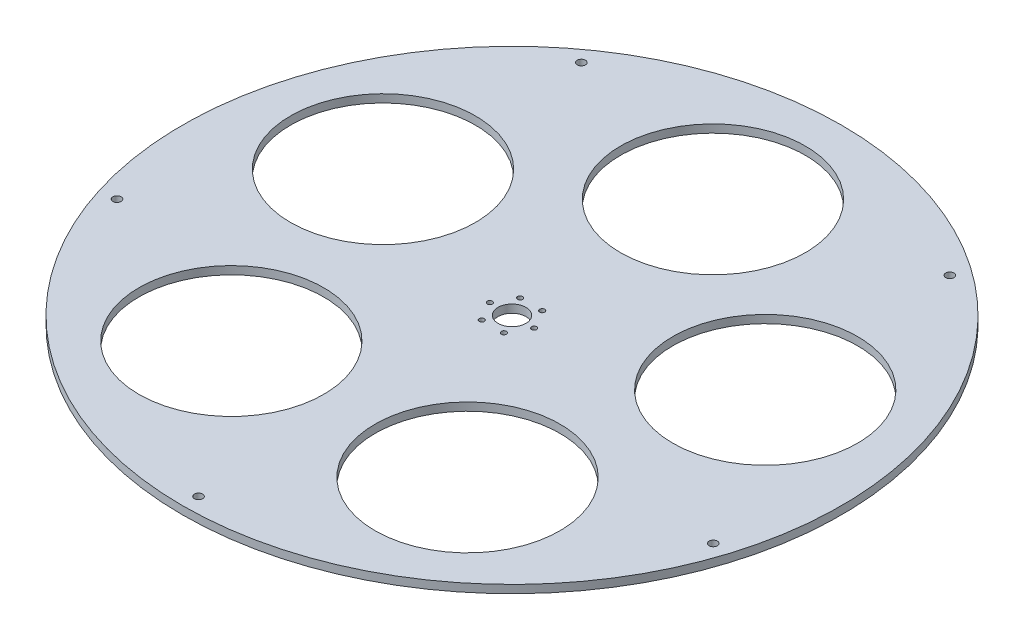
from build123d import *

# Parameters (mm, degrees)
SKETCH1_R              = 260.35
SKETCH1_R_2            = 73.025
BOSS_EXTRUDE1_DEPTH    = 6.35
SKETCH3_R              = 11
CUT_EXTRUDE1_DEPTH     = 374.646887366
F_10_32_TAPPED_HOLE1_D = 4.0386
SKETCH8_R              = 3.2512
CUT_EXTRUDE2_DEPTH     = 369.245254552


with BuildPart() as part:
    # Sketch1 → Boss-Extrude1 (new body)
    with BuildSketch(Plane(origin=(0, 0, 0), x_dir=(1, 0, 0), z_dir=(0, 1, 0))):
        Circle(SKETCH1_R)
        with Locations((0, 158.75)):
            Circle(SKETCH1_R_2, mode=Mode.SUBTRACT)
        with Locations((150.980221962, 49.056447857)):
            Circle(SKETCH1_R_2, mode=Mode.SUBTRACT)
        with Locations((93.310908801, -128.431447857)):
            Circle(SKETCH1_R_2, mode=Mode.SUBTRACT)
        with Locations((-93.310908801, -128.431447857)):
            Circle(SKETCH1_R_2, mode=Mode.SUBTRACT)
        with Locations((-150.980221962, 49.056447857)):
            Circle(SKETCH1_R_2, mode=Mode.SUBTRACT)
    extrude(amount=BOSS_EXTRUDE1_DEPTH)

    # Sketch3 → Cut-Extrude1 (cut, through all)
    with BuildSketch(Plane(origin=(-5.184519995, 6.35, -2.448578058), x_dir=(1, 0, 0), z_dir=(0, 1, 0))):
        with Locations((5.184519995, -2.448578058)):
            Circle(SKETCH3_R)
    extrude(amount=-CUT_EXTRUDE1_DEPTH, mode=Mode.SUBTRACT)

    # #10-32 Tapped Hole1 (through all)
    with Locations(Plane(origin=(-5.184519995, 6.35, -2.448578058), x_dir=(1, 0, 0), z_dir=(0, 1, 0))):
        with Locations((-3.546730005, 12.674390556), (13.915769995, 12.674390556), (22.647019995, -2.448578058), (13.915769995, -17.571546671), (-3.546730005, -17.571546671), (-12.277980005, -2.448578058)):
            Hole(F_10_32_TAPPED_HOLE1_D / 2)

    # Sketch8 → Cut-Extrude2 (cut, through all)
    with BuildSketch(Plane(origin=(0, 6.35, 0), x_dir=(1, 0, 0), z_dir=(0, 1, 0))):
        with Locations((0, -247.65)):
            Circle(SKETCH8_R)
        with Locations((-235.52914626, -76.528058657)):
            Circle(SKETCH8_R)
        with Locations((-145.56501773, 200.353058657)):
            Circle(SKETCH8_R)
        with Locations((145.56501773, 200.353058657)):
            Circle(SKETCH8_R)
        with Locations((235.52914626, -76.528058657)):
            Circle(SKETCH8_R)
    extrude(amount=-CUT_EXTRUDE2_DEPTH, mode=Mode.SUBTRACT)


solid = part.part
